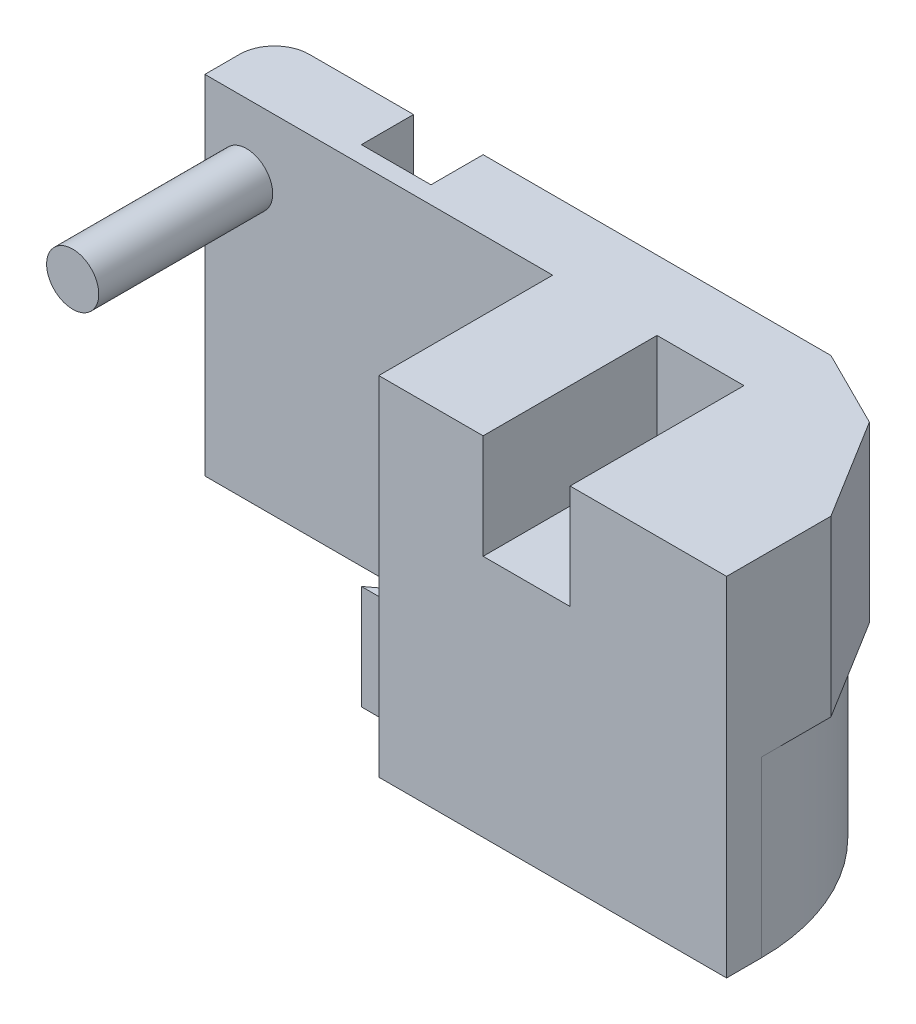
from build123d import *

# Parameters (mm, degrees)
SKICA1_W                 = 200
SKICA1_H                 = 100
P_IDAT_VYSUNUT_M1_DEPTH  = 20
P_IDAT_VYSUNUT_M2_DEPTH  = 50
SKICA7_R                 = 7.5
P_IDAT_VYSUNUT_M3_DEPTH  = 50
ODEBRAT_VYSUNUT_M3_DEPTH = 10
ZAOBLIT1_START           = 50
ZAOBLIT1_DEPTH           = 51
SKICA9_W                 = 40
SKICA9_H                 = 25
ODEBRAT_VYSUNUT_M4_DEPTH = 5
CHAMFER2_SIZE            = 5
FILLET2_DEPTH            = 50
CHAMFER3_SIZE            = 40
CHAMFER3_SIZE2           = 20
CHAMFER4_SIZE            = 20
SKETCH3_R                = 15
CUT_EXTRUDE2_DEPTH       = 60
SKETCH4_W                = 10
SKETCH4_H                = 20
CUT_EXTRUDE3_DEPTH       = 22
SKETCH5_W                = 20
SKETCH5_H                = 10
BOSS_EXTRUDE1_DEPTH      = 30


with BuildPart() as part:
    # Skica1 → Přidat vysunutím1 (new body)
    with BuildSketch(Plane.XY):
        with Locations((100, 50)):
            Rectangle(SKICA1_W, SKICA1_H)
    extrude(amount=P_IDAT_VYSUNUT_M1_DEPTH)

    # Skica2 → Přidat vysunutím2 (add)
    with BuildSketch(Plane.XY.offset(20)):
        Polygon((100, 0), (200, 0), (200, 100), (155, 100), (155, 70), (130, 70), (130, 100), (100, 100), align=None)
    extrude(amount=P_IDAT_VYSUNUT_M2_DEPTH)

    # Skica7 → Přidat vysunutím3 (add)
    with BuildSketch(Plane.XY.offset(20)):
        with Locations(Location((12, 80, 0), (0, 0, 180))):
            Circle(SKICA7_R)
    extrude(amount=P_IDAT_VYSUNUT_M3_DEPTH)

    # Skica8 → Odebrat vysunutím3 (cut, symmetric)
    with BuildSketch(Plane.ZY.offset(-50)):
        Polygon((0, 100), (0, 70), (15, 100), align=None)
    extrude(amount=ODEBRAT_VYSUNUT_M3_DEPTH, both=True, mode=Mode.SUBTRACT)

    # Zaoblit1: read off the stored shape, not the designer's step
    # Zaoblit1 outline → Zaoblit1 (cut)
    with BuildSketch(Plane(origin=(0, 0, 0), x_dir=(1, 0, 0), z_dir=(0, 1, 0)).offset(ZAOBLIT1_START)):
        with BuildLine():
            ThreePointArc((0, -10), (2.928932188, -2.928932188), (10, 0))
            Line((10, 0), (0, 0))
            Line((0, 0), (0, -10))
        make_face()
    extrude(amount=ZAOBLIT1_DEPTH, mode=Mode.SUBTRACT)

    # Skica9 → Odebrat vysunutím4 (cut)
    with BuildSketch(Plane(origin=(0, 0, 0), x_dir=(-1, 0, 0), z_dir=(0, 0, -1))):
        with Locations((-90, 77.5)):
            Rectangle(SKICA9_W, SKICA9_H)
    extrude(amount=-ODEBRAT_VYSUNUT_M4_DEPTH, mode=Mode.SUBTRACT)

    # Chamfer2
    chamfer2_edges = [part.edges().sort_by_distance(p)[0] for p in [
        (0, 25, 0),
    ]]
    chamfer(chamfer2_edges, length=CHAMFER2_SIZE)

    # Fillet2: read off the stored shape, not the designer's step
    # Fillet2 outline → Fillet2 (cut)
    with BuildSketch(Plane(origin=(0, 0, 0), x_dir=(1, 0, 0), z_dir=(0, 1, 0))):
        with BuildLine():
            Line((200, 0), (140, 0))
            ThreePointArc((140, 0), (182.426406871, -17.573593129), (200, -60))
            Line((200, -60), (200, 0))
        make_face()
    extrude(amount=FILLET2_DEPTH, mode=Mode.SUBTRACT)

    # Chamfer3
    chamfer3_edges = [part.edges().sort_by_distance(p)[0] for p in [
        (200, 75, 0),
    ]]
    chamfer3_side = [part.faces().sort_by_distance(p)[0] for p in [
        (93.302047782, 51.38225256, 0),
    ]]
    chamfer(chamfer3_edges, length=CHAMFER3_SIZE, length2=CHAMFER3_SIZE2, reference=chamfer3_side[0])

    # Chamfer4
    chamfer4_edges = [part.edges().sort_by_distance(p)[0] for p in [
        (200, 75, 20),
    ]]
    chamfer(chamfer4_edges, length=CHAMFER4_SIZE)

    # Sketch2 → Cut-Revolve4 (revolve, cut)
    with BuildSketch(Plane(origin=(0, 0, 0), x_dir=(-1, 0, 0), z_dir=(0, 0, -1))):
        with BuildLine():
            Line((-50, 35), (-50, 5))
            ThreePointArc((-50, 5), (-35, 20), (-50, 35))
        make_face()
    revolve(axis=Axis((50, 35, 0), (0, -1, 0)), mode=Mode.SUBTRACT)

    # Sketch3 → Cut-Extrude2 (cut)
    with BuildSketch(Plane(origin=(0, 0, 0), x_dir=(-1, 0, 0), z_dir=(0, 0, -1))):
        with Locations((-120, 20)):
            Circle(SKETCH3_R)
    extrude(amount=-CUT_EXTRUDE2_DEPTH, mode=Mode.SUBTRACT)

    # Sketch4 → Cut-Extrude3 (cut)
    with BuildSketch(Plane.ZY.offset(-100)):
        with Locations((50, 80)):
            Rectangle(SKETCH4_W, SKETCH4_H)
    extrude(amount=-CUT_EXTRUDE3_DEPTH, mode=Mode.SUBTRACT)

    # Sketch5 → Boss-Extrude1 (add)
    with BuildSketch(Plane.XZ):
        Polygon((80, 55), (100, 40), (100, 55), align=None)
        with Locations((90, 35)):
            Rectangle(SKETCH5_W, SKETCH5_H)
    extrude(amount=-BOSS_EXTRUDE1_DEPTH)


solid = part.part
